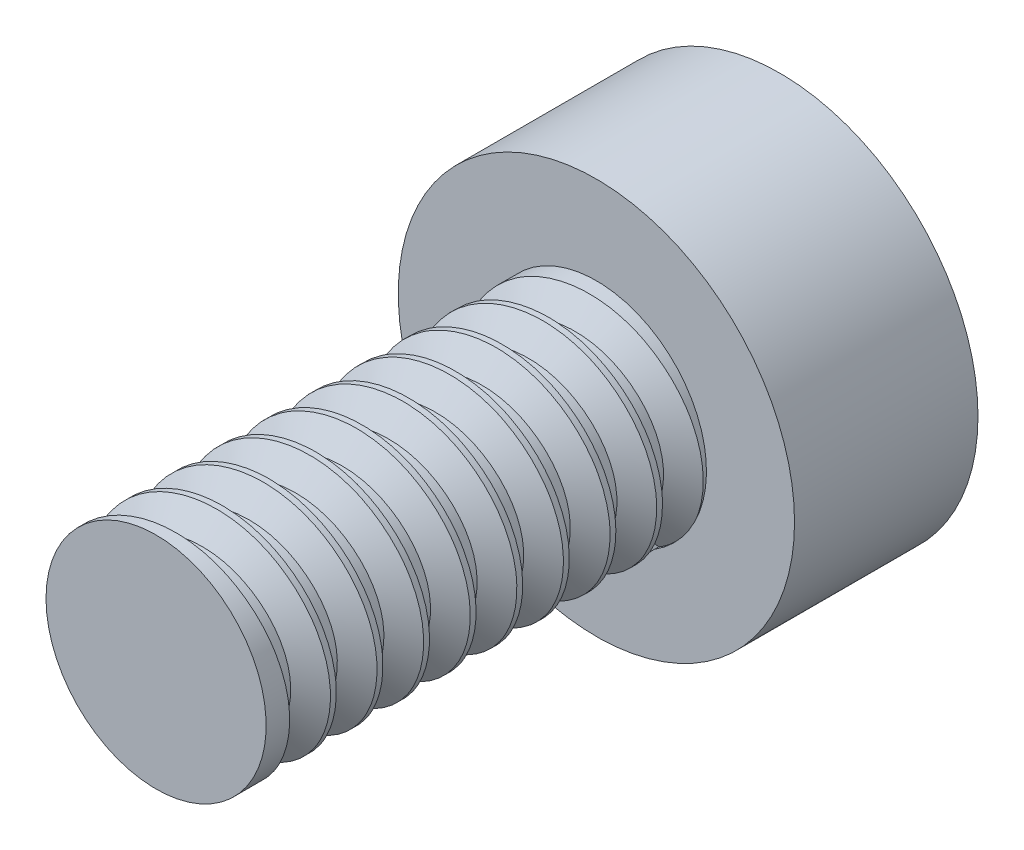
from build123d import *

# Parameters (mm, degrees)
SKETCH_1_R          = 2.7
EXTRUDE_1_DEPTH     = 2.5
SKETCH_2_R          = 1.5
EXTRUDE_2_DEPTH     = 6
THREAD_1_PITCH      = 0.635
CUT_EXTRUDE_1_DEPTH = 0.5


with BuildPart() as part:
    # Sketch 1 → 凸台-拉伸1 (new body)
    with BuildSketch(Plane.XY):
        Circle(SKETCH_1_R)
    extrude(amount=EXTRUDE_1_DEPTH)

    # 草图2 → 凸台-拉伸2 (add)
    with BuildSketch(Plane.XY.offset(2.5)):
        Circle(SKETCH_2_R)
    extrude(amount=EXTRUDE_2_DEPTH)

    # 螺纹线1: the profile of Sketch 1 2 profile screwed along a right-hand helix of 8.661417 turns, 6 arcs to a turn; built about Z, then put on its axis
    thread_1_z = Axis((0, 0, 0), (0, 0, 1))
    thread_1_corners = [(1.5003, 0, -0.000173205), (1.5003, 0, 0.555798203), (1.156296169, 0, 0.357187499), (1.156296169, 0, 0.198437499)]
    with BuildLine(mode=Mode.PRIVATE) as thread_1_profile:
        Line(thread_1_corners[0], thread_1_corners[1])
        Line(thread_1_corners[1], thread_1_corners[2])
        Line(thread_1_corners[2], thread_1_corners[3])
        Line(thread_1_corners[3], thread_1_corners[0])
    thread_1_cap = Face(thread_1_profile.wire())
    thread_1_turn_angles = [0, 30, 60, 90, 120, 150, 180, 210, 240, 270, 300, 330, 360]
    thread_1_turn_weights = [1, 0.8660254037844387, 1, 0.8660254037844387, 1, 0.8660254037844387, 1, 0.8660254037844387, 1, 0.8660254037844387, 1, 0.8660254037844387, 1]
    thread_1_turn_rails = [Edge.make_bspline([Vector(p[0], p[1], 0).rotate(thread_1_z, thread_1_turn_angles[k]) / thread_1_turn_weights[k] + Vector(0, 0, p[2] + THREAD_1_PITCH * thread_1_turn_angles[k] / 360) for k in range(13)], [0, 0, 0, 1, 1, 2, 2, 3, 3, 4, 4, 5, 5, 6, 6, 6], 2, thread_1_turn_weights) for p in thread_1_corners]
    thread_1_turn_sides = [Face.make_surface_from_curves(thread_1_turn_rails[p[0]], thread_1_turn_rails[p[1]]) for p in [(0, 1), (1, 2), (2, 3), (3, 0)]]
    thread_1_last_angles = [2880, 2910, 2940, 2970, 3000, 3030, 3060, 3089.05511811, 3118.11023622]
    thread_1_last_weights = [1, 0.8660254037844387, 1, 0.8660254037844387, 1, 0.8660254037844387, 1, 0.8741529192927529, 1]
    thread_1_last_rails = [Edge.make_bspline([Vector(p[0], p[1], 0).rotate(thread_1_z, thread_1_last_angles[k]) / thread_1_last_weights[k] + Vector(0, 0, p[2] + THREAD_1_PITCH * thread_1_last_angles[k] / 360) for k in range(9)], [0, 0, 0, 1, 1, 2, 2, 3, 3, 4, 4, 4], 2, thread_1_last_weights) for p in thread_1_corners]
    thread_1_last_sides = [Face.make_surface_from_curves(thread_1_last_rails[p[0]], thread_1_last_rails[p[1]]) for p in [(0, 1), (1, 2), (2, 3), (3, 0)]]
    thread_1 = Plane(origin=(0, 0, 8.5), x_dir=(-1, 0, 0), z_dir=(0, 0, -1)) * Solid(Shell([*[p.moved(Location((0, 0, THREAD_1_PITCH * i))) for i in range(8) for p in thread_1_turn_sides], *thread_1_last_sides, thread_1_cap, thread_1_cap.rotate(thread_1_z, 3118.11023622).moved(Location((0, 0, THREAD_1_PITCH * 3118.11023622 / 360)))]))
    add(thread_1, mode=Mode.SUBTRACT)

    # 草图6 → 切除-拉伸1 (cut)
    with BuildSketch(Plane(origin=(0, 0, 0), x_dir=(-1, 0, 0), z_dir=(0, 0, -1))):
        Polygon((1.54329777, -0.7862773), (1.452585001, 0.943396425), (-0.090712769, 1.729673725), (-1.54329777, 0.7862773), (-1.452585001, -0.943396425), (0.090712769, -1.729673725), align=None)
    extrude(amount=-CUT_EXTRUDE_1_DEPTH, mode=Mode.SUBTRACT)


solid = part.part
